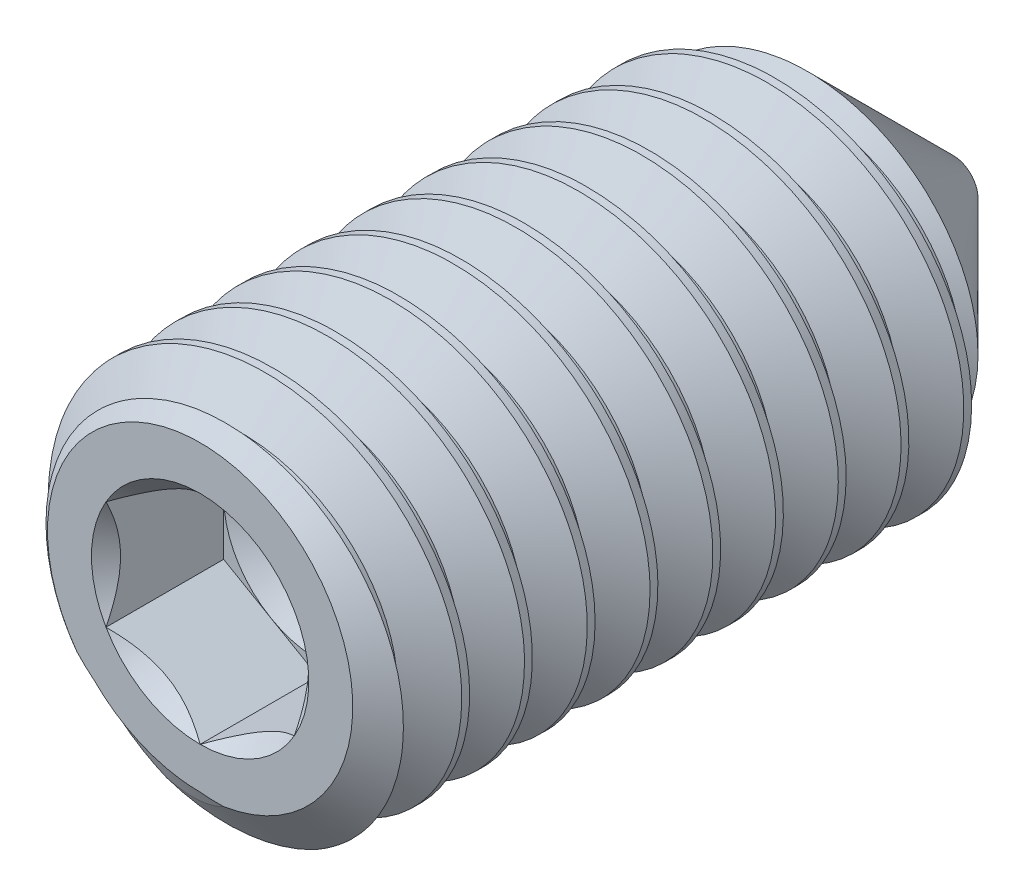
from build123d import *

# Parameters (mm, degrees)
CUT_SWEEP2_PITCH    = 0.79375
CUT_EXTRUDE10_DEPTH = 1.48828125


with BuildPart() as part:
    # Sketch22 → Revolve1 (revolve)
    with BuildSketch(Plane(origin=(0, 0, 0), x_dir=(0, 0, -1), z_dir=(1, 0, 0)), mode=Mode.PRIVATE) as revolve1_sk:
        Polygon((-4.7625, 0), (-4.7625, 1.9304), (-4.424579842, 2.413), (2.66319, 2.413), (4.7625, 0.31369), (4.7625, 0), align=None)
    revolve(revolve1_sk.sketch.rotate(Axis((0, 0, -4.7625), (0, 0, 1)), 90), axis=Axis((0, 0, -4.7625), (0, 0, 1)))

    # Cut-Sweep2: the profile of Sketch28 profile screwed along a right-hand helix of 13 turns, 8 arcs to a turn; built about Z, then put on its axis
    cut_sweep2_z = Axis((0, 0, 0), (0, 0, 1))
    cut_sweep2_corners = [(2.4133, 0, 0.000173205), (2.4133, 0, -0.694704455), (1.897444252, 0, -0.396875), (1.897444252, 0, -0.29765625)]
    with BuildLine(mode=Mode.PRIVATE) as cut_sweep2_profile:
        Line(cut_sweep2_corners[0], cut_sweep2_corners[1])
        Line(cut_sweep2_corners[1], cut_sweep2_corners[2])
        Line(cut_sweep2_corners[2], cut_sweep2_corners[3])
        Line(cut_sweep2_corners[3], cut_sweep2_corners[0])
    cut_sweep2_cap = Face(cut_sweep2_profile.wire())
    cut_sweep2_turn_angles = [0, 22.5, 45, 67.5, 90, 112.5, 135, 157.5, 180, 202.5, 225, 247.5, 270, 292.5, 315, 337.5, 360]
    cut_sweep2_turn_weights = [1, 0.9238795325112867, 1, 0.9238795325112867, 1, 0.9238795325112867, 1, 0.9238795325112867, 1, 0.9238795325112867, 1, 0.9238795325112867, 1, 0.9238795325112867, 1, 0.9238795325112867, 1]
    cut_sweep2_turn_rails = [Edge.make_bspline([Vector(p[0], p[1], 0).rotate(cut_sweep2_z, cut_sweep2_turn_angles[k]) / cut_sweep2_turn_weights[k] + Vector(0, 0, p[2] + CUT_SWEEP2_PITCH * cut_sweep2_turn_angles[k] / 360) for k in range(17)], [0, 0, 0, 1, 1, 2, 2, 3, 3, 4, 4, 5, 5, 6, 6, 7, 7, 8, 8, 8], 2, cut_sweep2_turn_weights) for p in cut_sweep2_corners]
    cut_sweep2_turn_sides = [Face.make_surface_from_curves(cut_sweep2_turn_rails[p[0]], cut_sweep2_turn_rails[p[1]]) for p in [(0, 1), (1, 2), (2, 3), (3, 0)]]
    cut_sweep2 = Plane(origin=(0, 0, -4.7625), x_dir=(0, 1, 0), z_dir=(0, 0, 1)) * Solid(Shell([*[p.moved(Location((0, 0, CUT_SWEEP2_PITCH * i))) for i in range(13) for p in cut_sweep2_turn_sides], cut_sweep2_cap, cut_sweep2_cap.rotate(cut_sweep2_z, 4680).moved(Location((0, 0, CUT_SWEEP2_PITCH * 4680 / 360)))]))
    add(cut_sweep2, mode=Mode.SUBTRACT)

    # Sketch23 → Cut-Extrude10 (cut)
    with BuildSketch(Plane.XY.offset(4.7625)):
        Polygon((0, 1.374815329), (-1.190625, 0.687407664), (-1.190625, -0.687407664), (0, -1.374815329), (1.190625, -0.687407664), (1.190625, 0.687407664), align=None)
    extrude(amount=-CUT_EXTRUDE10_DEPTH, mode=Mode.SUBTRACT)

    # Cut-Extrude11 cone 1 section (through the dimple's axis) → Cut-Extrude11 (revolve, cut)
    with BuildSketch(Plane(origin=(0, 0, 4.7625), x_dir=(0, -1, 0), z_dir=(1, 0, 0))):
        Polygon((0, 0), (1.374815329, 0), (0, 1.374815329), align=None)
    revolve(axis=Axis((0, 0, 4.7625), (0, 0, -1)), mode=Mode.SUBTRACT)

    # Cut-Extrude12 cone 1 section (through the dimple's axis) → Cut-Extrude12 (revolve, cut)
    with BuildSketch(Plane(origin=(0, 0, 3.27421875), x_dir=(0, -1, 0), z_dir=(1, 0, 0))):
        Polygon((0, 0), (1.190625, 0), (0, 0.687407664), align=None)
    revolve(axis=Axis((0, 0, 3.27421875), (0, 0, -1)), mode=Mode.SUBTRACT)


solid = part.part
